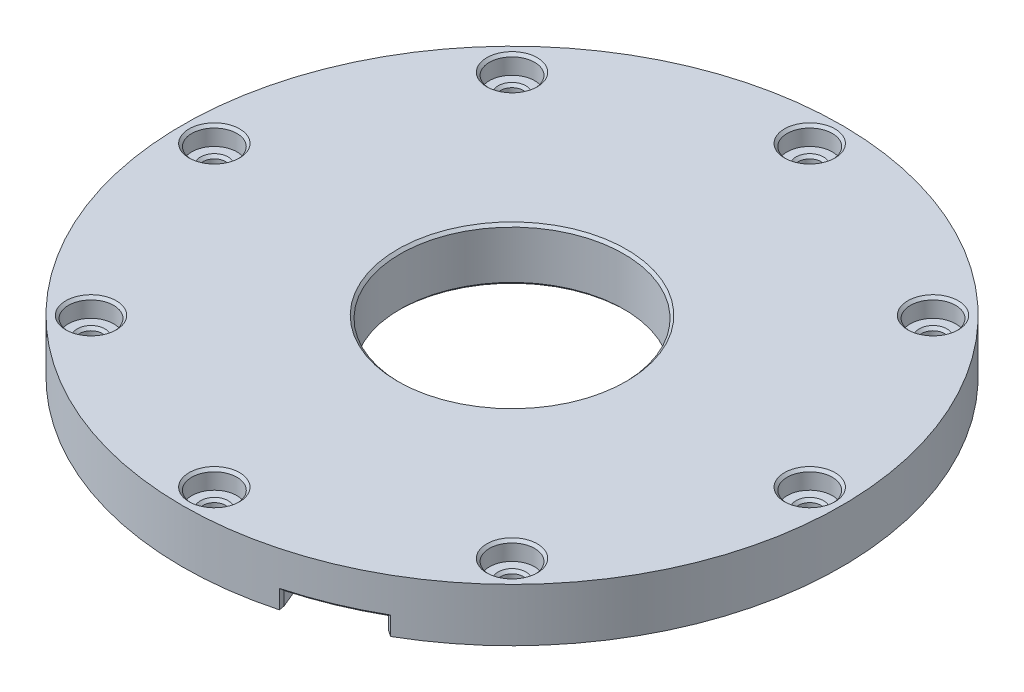
from build123d import *

# Parameters (mm, degrees)
SKETCH1_R           = 62
SKETCH1_R_2         = 21.025
BOSS_EXTRUDE1_DEPTH = 10
SKETCH3_R           = 2.1
CUT_EXTRUDE1_DEPTH  = 89.249645892
CIRPATTERN1_COUNT   = 8
SKETCH5_R           = 4.25
CUT_EXTRUDE3_DEPTH  = 3.5
CUT_EXTRUDE2_DEPTH  = 3
CHAMFER1_SIZE       = 0.5
CHAMFER2_SIZE       = 0.5
CHAMFER3_SIZE       = 0.5
CHAMFER4_SIZE       = 0.5
CHAMFER5_SIZE       = 0.5
CHAMFER5_SIZE_2     = 0.448841824


with BuildPart() as part:
    # Sketch1 → Boss-Extrude1 (new body)
    with BuildSketch(Plane(origin=(0, 0, 0), x_dir=(1, 0, 0), z_dir=(0, 1, 0))):
        with Locations(Location((0, 0, 0), (0, 0, 270))):
            Circle(SKETCH1_R)
        with Locations(Location((0, 0, 0), (0, 0, 270))):
            Circle(SKETCH1_R_2, mode=Mode.SUBTRACT)
    extrude(amount=BOSS_EXTRUDE1_DEPTH)

    # Sketch3 → Cut-Extrude1 (cut, through all)
    with BuildSketch(Plane(origin=(0, 10, 0), x_dir=(1, 0, 0), z_dir=(0, 1, 0))):
        with Locations(Location((-56, 0, 0), (0, 0, 270))):
            Circle(SKETCH3_R)
    cut_extrude1 = extrude(amount=-CUT_EXTRUDE1_DEPTH, mode=Mode.SUBTRACT)

    # CirPattern1: Cut-Extrude1 ×8 about axis
    cirpattern1_axis = Axis((0, 0, 0), (0, 1, 0))
    for i in range(1, CIRPATTERN1_COUNT):
        add(cut_extrude1.rotate(cirpattern1_axis, i * 360 / CIRPATTERN1_COUNT), mode=Mode.SUBTRACT)

    # Sketch5 → Cut-Extrude3 (cut)
    with BuildSketch(Plane(origin=(0, 10, 0), x_dir=(1, 0, 0), z_dir=(0, 1, 0))):
        with Locations(Location((39.597979746, 39.597979746, 0), (0, 0, 270))):
            Circle(SKETCH5_R)
    extrude(amount=-CUT_EXTRUDE3_DEPTH, mode=Mode.SUBTRACT)

    # Sketch4 → Cut-Extrude2 (cut)
    with BuildSketch(Plane.XZ):
        with BuildLine():
            ThreePointArc((30.503162375, 53.977375679), (27.165020613, 55.732052314), (23.72637336, 57.280530787))
            ThreePointArc((23.72637336, 57.280530787), (20.1999424, 58.617082212), (16.59877541, 59.736761336))
            Line((16.59877541, 59.736761336), (4.528309489, 30.596078804))
            Line((4.528309489, 30.596078804), (18.432696453, 24.836693147))
            Line((18.432696453, 24.836693147), (30.503162375, 53.977375679))
        make_face()
    extrude(amount=-CUT_EXTRUDE2_DEPTH, mode=Mode.SUBTRACT)

    # Chamfer1
    chamfer1_edges = [part.edges().sort_by_distance(p)[0] for p in [
        (39.597979746, 10, -43.847979746),
        (41.082903987, 6.5, -38.113055506),
    ]]
    chamfer(chamfer1_edges, length=CHAMFER1_SIZE)

    # CirPattern2: read off the stored shape, not the designer's step
    # CirPattern2 outline → CirPattern2 (revolve, cut)
    with BuildSketch(Plane.XY.offset(56)):
        Polygon((2.1, 10), (2.1, 6.5), (4.25, 6.5), (4.25, 9.5), (4.75, 10), align=None)
    revolve(axis=Axis((0, 0, 56), (0, 1, 0)), mode=Mode.SUBTRACT)

    # CirPattern2 2 outline → CirPattern2 2 (revolve, cut)
    with BuildSketch(Plane(origin=(39.597979746, 0, 39.597979746), x_dir=(1, 0, 0), z_dir=(0, 0, 1))):
        Polygon((2.1, 10), (2.1, 6.5), (4.25, 6.5), (4.25, 9.5), (4.75, 10), align=None)
    revolve(axis=Axis((39.597979746, 0, 39.597979746), (0, 1, 0)), mode=Mode.SUBTRACT)

    # CirPattern2 3 outline → CirPattern2 3 (revolve, cut)
    with BuildSketch(Plane(origin=(56, 0, 0), x_dir=(1, 0, 0), z_dir=(0, 0, 1))):
        Polygon((2.1, 10), (2.1, 6.5), (4.25, 6.5), (4.25, 9.5), (4.75, 10), align=None)
    revolve(axis=Axis((56, 0, 0), (0, 1, 0)), mode=Mode.SUBTRACT)

    # CirPattern2 4 outline → CirPattern2 4 (revolve, cut)
    with BuildSketch(Plane.XY.offset(-56)):
        Polygon((2.1, 10), (2.1, 6.5), (4.25, 6.5), (4.25, 9.5), (4.75, 10), align=None)
    revolve(axis=Axis((0, 0, -56), (0, 1, 0)), mode=Mode.SUBTRACT)

    # CirPattern2 5 outline → CirPattern2 5 (revolve, cut)
    with BuildSketch(Plane(origin=(-39.597979746, 0, -39.597979746), x_dir=(1, 0, 0), z_dir=(0, 0, 1))):
        Polygon((2.1, 10), (2.1, 6.5), (4.25, 6.5), (4.25, 9.5), (4.75, 10), align=None)
    revolve(axis=Axis((-39.597979746, 0, -39.597979746), (0, 1, 0)), mode=Mode.SUBTRACT)

    # CirPattern2 6 outline → CirPattern2 6 (revolve, cut)
    with BuildSketch(Plane(origin=(-39.597979746, 0, 39.597979746), x_dir=(1, 0, 0), z_dir=(0, 0, 1))):
        Polygon((2.1, 10), (2.1, 6.5), (4.25, 6.5), (4.25, 9.5), (4.75, 10), align=None)
    revolve(axis=Axis((-39.597979746, 0, 39.597979746), (0, 1, 0)), mode=Mode.SUBTRACT)

    # CirPattern2 7 outline → CirPattern2 7 (revolve, cut)
    with BuildSketch(Plane(origin=(-56, 0, 0), x_dir=(1, 0, 0), z_dir=(0, 0, 1))):
        Polygon((2.1, 10), (2.1, 6.5), (4.25, 6.5), (4.25, 9.5), (4.75, 10), align=None)
    revolve(axis=Axis((-56, 0, 0), (0, 1, 0)), mode=Mode.SUBTRACT)

    # Chamfer2
    chamfer2_edges = [part.edges().sort_by_distance(p)[0] for p in [
        (38.113055505, 6.5, 41.082903986),
        (56, 6.5, 2.1),
        (2.1, 6.5, -56),
        (-38.113055505, 6.5, -41.082903986),
        (-56, 6.5, -2.1),
        (-41.082903986, 6.5, 38.113055505),
        (-2.1, 6.5, 56),
    ]]
    chamfer(chamfer2_edges, length=CHAMFER2_SIZE)

    # Chamfer3
    chamfer3_edges = [part.edges().sort_by_distance(p)[0] for p in [
        (0, 0, -21.025),
        (0, 10, -21.025),
    ]]
    chamfer(chamfer3_edges, length=CHAMFER3_SIZE)

    # Chamfer4
    chamfer4_edges = [part.edges().sort_by_distance(p)[0] for p in [
        (24.467929414, 0, 39.407034413),
        (10.56354245, 0, 45.16642007),
        (11.480502971, 0, 27.716385975),
    ]]
    chamfer(chamfer4_edges, length=CHAMFER4_SIZE)

    # Chamfer5
    # the kernel refuses this chamfer: 0.5, 0.448841824 mm, written as the material it takes off along each edge
    with BuildSketch(Plane(origin=(30.503162375, -0.785841494, 53.977375679), x_dir=(0.868821324088061, 0, -0.49512574848200785), z_dir=(0, 1, 0))) as chamfer5_piece_1:
        with BuildLine():
            Line((0.447581222, 0), (CHAMFER5_SIZE * 0.124953018626, CHAMFER5_SIZE * 0.992162659616))
            Line((CHAMFER5_SIZE * 0.124953018626, CHAMFER5_SIZE * 0.992162659616), (0, 0))
            ThreePointArc((0, 0), (0.229921968, -0.000403587), (0.447581222, 0))
        make_face()
    extrude(amount=3.785841494, mode=Mode.SUBTRACT)
    with BuildSketch(Plane(origin=(0, 3, 0), x_dir=(0.5099353263138355, 0, 0.8602127428591152), z_dir=(0.8602127428591152, 0, -0.5099353263138355))) as chamfer5_piece_2_section:
        Polygon((62, -CHAMFER5_SIZE), (62 - CHAMFER5_SIZE, 0), (62, 0), align=None)
    chamfer5_piece_2 = revolve(axis=Axis((0, 3, 0), (0, -1, 0)), revolution_arc=16.319043914, mode=Mode.PRIVATE)
    chamfer5_piece_2 = split(chamfer5_piece_2, bisect_by=Plane(origin=(-6.952193482, 3, 2.879692829), z_dir=(0.9238795325112891, 0, -0.3826834323650844)), keep=Keep.TOP, mode=Mode.PRIVATE)
    chamfer5_piece_2 = split(chamfer5_piece_2, bisect_by=Plane(origin=(6.952193482, 3, -2.879692829), z_dir=(-0.923879532511289, 0, 0.38268343236508445)), keep=Keep.TOP, mode=Mode.PRIVATE)
    add(chamfer5_piece_2, mode=Mode.SUBTRACT)
    with BuildSketch(Plane(origin=(16.59877541, -0.780714965, 59.736761336), x_dir=(-0.9645635955346866, 0, 0.26385046933670087), z_dir=(0, 1, 0))) as chamfer5_piece_3:
        with BuildLine():
            Line((0.498003952, 0), (CHAMFER5_SIZE_2 * 0.125356459071, -CHAMFER5_SIZE_2 * 0.992111765865))
            Line((CHAMFER5_SIZE_2 * 0.125356459071, -CHAMFER5_SIZE_2 * 0.992111765865), (0, 0))
            ThreePointArc((0, 0), (0.256043839, 0.000499618), (0.498003952, 0))
        make_face()
    extrude(amount=3.780714965, mode=Mode.SUBTRACT)
    with BuildSketch(Plane(origin=(0, 3, 0), x_dir=(0.5099353263138355, 0, 0.8602127428591152), z_dir=(0.8602127428591152, 0, -0.5099353263138355))) as chamfer5_piece_4a_section:
        Polygon((62, -CHAMFER5_SIZE), (62 - CHAMFER5_SIZE, 0), (62, 0), align=None)
    chamfer5_piece_4a = revolve(axis=Axis((0, 3, 0), (0, -1, 0)), revolution_arc=16.319043914, mode=Mode.PRIVATE)
    chamfer5_piece_4a = split(chamfer5_piece_4a, bisect_by=Plane(origin=(6.952193482, 3, -2.879692829), z_dir=(0.923879532511289, 0, -0.38268343236508445)), keep=Keep.TOP, mode=Mode.PRIVATE)
    with BuildSketch(Plane(origin=(30.503162375, -0.785841494, 53.977375679), x_dir=(0.868821324088061, 0, -0.49512574848200785), z_dir=(0, 1, 0))) as chamfer5_piece_4b_section:
        with BuildLine():
            Line((0.447581222, 0), (CHAMFER5_SIZE * 0.124953018626, CHAMFER5_SIZE * 0.992162659616))
            Line((CHAMFER5_SIZE * 0.124953018626, CHAMFER5_SIZE * 0.992162659616), (0, 0))
            ThreePointArc((0, 0), (0.229921968, -0.000403587), (0.447581222, 0))
        make_face()
    chamfer5_piece_4b = extrude(amount=5.071682988, mode=Mode.PRIVATE)
    chamfer5_piece_4b = split(chamfer5_piece_4b, bisect_by=Plane(origin=(30.503162375, 3, 53.977375679), z_dir=(0, 1, 0)), keep=Keep.TOP, mode=Mode.PRIVATE)
    chamfer5_piece_4 = chamfer5_piece_4a & chamfer5_piece_4b
    add(chamfer5_piece_4, mode=Mode.SUBTRACT)
    with BuildSketch(Plane(origin=(16.59877541, -0.780714965, 59.736761336), x_dir=(-0.9645635955346866, 0, 0.26385046933670087), z_dir=(0, 1, 0))) as chamfer5_piece_5a_section:
        with BuildLine():
            Line((0.498003952, 0), (CHAMFER5_SIZE_2 * 0.125356459071, -CHAMFER5_SIZE_2 * 0.992111765865))
            Line((CHAMFER5_SIZE_2 * 0.125356459071, -CHAMFER5_SIZE_2 * 0.992111765865), (0, 0))
            ThreePointArc((0, 0), (0.256043839, 0.000499618), (0.498003952, 0))
        make_face()
    chamfer5_piece_5a = extrude(amount=5.06142993, mode=Mode.PRIVATE)
    chamfer5_piece_5a = split(chamfer5_piece_5a, bisect_by=Plane(origin=(16.59877541, 3, 59.736761336), z_dir=(0, 1, 0)), keep=Keep.TOP, mode=Mode.PRIVATE)
    with BuildSketch(Plane(origin=(0, 3, 0), x_dir=(0.5099353263138355, 0, 0.8602127428591152), z_dir=(0.8602127428591152, 0, -0.5099353263138355))) as chamfer5_piece_5b_section:
        Polygon((62, -CHAMFER5_SIZE), (62 - CHAMFER5_SIZE, 0), (62, 0), align=None)
    chamfer5_piece_5b = revolve(axis=Axis((0, 3, 0), (0, -1, 0)), revolution_arc=16.319043914, mode=Mode.PRIVATE)
    chamfer5_piece_5b = split(chamfer5_piece_5b, bisect_by=Plane(origin=(-6.952193482, 3, 2.879692829), z_dir=(-0.9238795325112891, 0, 0.3826834323650844)), keep=Keep.TOP, mode=Mode.PRIVATE)
    chamfer5_piece_5 = chamfer5_piece_5a & chamfer5_piece_5b
    add(chamfer5_piece_5, mode=Mode.SUBTRACT)


solid = part.part
